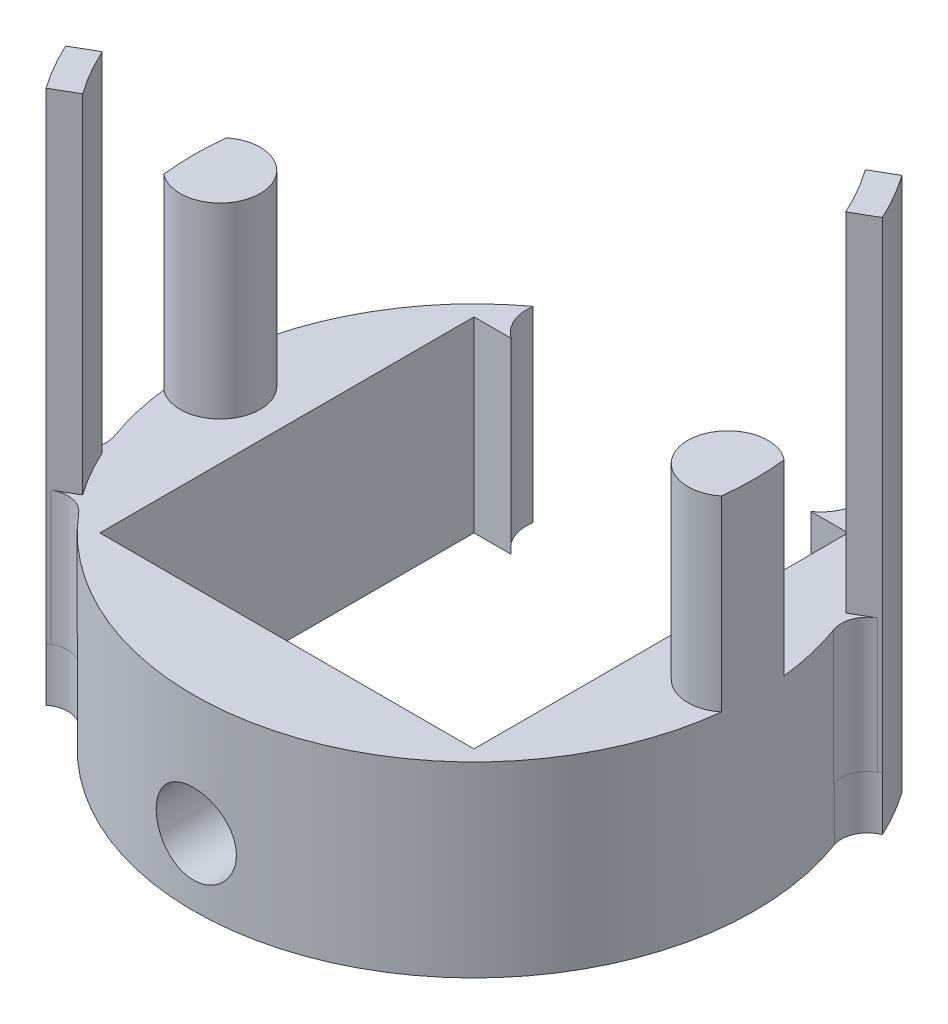
from build123d import *
from build123d.topology import SkipClean

# Parameters (mm, degrees)
SKETCH1_R               = 10.5
BOSS_EXTRUDE1_DEPTH     = 7
BOSS_EXTRUDE2_DEPTH     = 7
BOSS_EXTRUDE4_START     = -5
BOSS_EXTRUDE4_DEPTH     = 5
SKETCH5_R               = 1.5
CUT_EXTRUDE2_DEPTH      = 5
BOSS_EXTRUDE5_DEPTH     = 13
CUT_EXTRUDE4_DEPTH      = 26.013546021
CUT_EXTRUDE4_DEPTH_BACK = 26.013546021
FILLET1_R               = 1
CUT_EXTRUDE5_DEPTH      = 20.866491554
CUT_EXTRUDE5_DEPTH_BACK = 20.866491554
SKETCH9_R               = 15
SKETCH9_R_2             = 11.5
SKETCH10_R              = 1.5
CUT_EXTRUDE6_DEPTH      = 11.2
CUT_EXTRUDE7_DEPTH      = 24.334523869
CUT_EXTRUDE7_DEPTH_BACK = 24.334523869
SKETCH12_R              = 4.652991158
SKETCH12_R_2            = 1.5
BOSS_EXTRUDE6_START     = 2
BOSS_EXTRUDE6_DEPTH     = 2


with BuildPart() as part:
    # Sketch1 → Boss-Extrude1 (new body)
    with BuildSketch(Plane(origin=(0, 0, 0), x_dir=(1, 0, 0), z_dir=(0, 1, 0))):
        with Locations(Location((0, 0, 0), (0, 0, 270))):
            Circle(SKETCH1_R)
        Polygon((7, -7), (7, 0), (7, 7), (-7, 7), (-7, -7), align=None, mode=Mode.SUBTRACT)
    extrude(amount=BOSS_EXTRUDE1_DEPTH)

    # Sketch2 → Boss-Extrude2 (add)
    with BuildSketch(Plane(origin=(0, 7, 0), x_dir=(1, 0, 0), z_dir=(0, 1, 0))):
        with BuildLine():
            ThreePointArc((-10.434210526, -1.173563246), (-8.848584537, -1.351169084), (-8, 0))
            ThreePointArc((-8, 0), (-8.848584537, 1.351169084), (-10.434210526, 1.173563246))
            ThreePointArc((-10.434210526, 1.173563246), (-10.5, 0), (-10.434210526, -1.173563246))
        make_face()
        with BuildLine():
            ThreePointArc((10.434210526, 1.173563246), (8.848584537, 1.351169084), (8, 0))
            ThreePointArc((8, 0), (8.848584537, -1.351169084), (10.434210526, -1.173563246))
            ThreePointArc((10.434210526, -1.173563246), (10.5, 0), (10.434210526, 1.173563246))
        make_face()
    extrude(amount=BOSS_EXTRUDE2_DEPTH)

    # Sketch4 → Boss-Extrude4 (add)
    with BuildSketch(Plane(origin=(0, 7, 0), x_dir=(1, 0, 0), z_dir=(0, 1, 0)).offset(BOSS_EXTRUDE4_START)):
        with BuildLine():
            Line((-10.392304845, -6), (-9.09326674, -5.25))
            ThreePointArc((-9.09326674, -5.25), (-9.333212128, -4.810525062), (-9.551933495, -4.360110836))
            Line((-9.551933495, -4.360110836), (-10.743718377, -5.048188159))
            ThreePointArc((-10.743718377, -5.048188159), (-10.608541774, -5.539058011), (-10.392304845, -6))
        make_face()
        with BuildLine():
            Line((-9.09326674, -5.25), (-7, -4.041451884))
            Line((-7, -4.041451884), (-7, -2.886751346))
            Line((-7, -2.886751346), (-9.551933495, -4.360110836))
            ThreePointArc((-9.551933495, -4.360110836), (-9.333212128, -4.810525062), (-9.09326674, -5.25))
        make_face()
        with BuildLine():
            Line((-7, -5.196152423), (-7, -4.041451884))
            Line((-7, -4.041451884), (-9.09326674, -5.25))
            ThreePointArc((-9.09326674, -5.25), (-8.832642973, -5.677536271), (-8.551933495, -6.092161644))
            Line((-8.551933495, -6.092161644), (-7, -5.196152423))
        make_face()
        with BuildLine():
            ThreePointArc((-8.551933495, -6.092161644), (-8.832642973, -5.677536271), (-9.09326674, -5.25))
            Line((-9.09326674, -5.25), (-10.392304845, -6))
            ThreePointArc((-10.392304845, -6), (-10.101235838, -6.417737668), (-9.743718377, -6.780238966))
            Line((-9.743718377, -6.780238966), (-8.551933495, -6.092161644))
        make_face()
        with BuildLine():
            ThreePointArc((8.551933495, 6.092161644), (8.832642973, 5.677536271), (9.09326674, 5.25))
            Line((9.09326674, 5.25), (10.392304845, 6))
            ThreePointArc((10.392304845, 6), (10.101235838, 6.417737668), (9.743718377, 6.780238966))
            Line((9.743718377, 6.780238966), (8.551933495, 6.092161644))
        make_face()
        with BuildLine():
            Line((10.392304845, 6), (9.09326674, 5.25))
            ThreePointArc((9.09326674, 5.25), (9.333212128, 4.810525062), (9.551933495, 4.360110836))
            Line((9.551933495, 4.360110836), (10.743718377, 5.048188159))
            ThreePointArc((10.743718377, 5.048188159), (10.608541774, 5.539058011), (10.392304845, 6))
        make_face()
        with BuildLine():
            Line((7, 5.196152423), (7, 4.041451884))
            Line((7, 4.041451884), (9.09326674, 5.25))
            ThreePointArc((9.09326674, 5.25), (8.832642973, 5.677536271), (8.551933495, 6.092161644))
            Line((8.551933495, 6.092161644), (7, 5.196152423))
        make_face()
        with BuildLine():
            Line((9.09326674, 5.25), (7, 4.041451884))
            Line((7, 4.041451884), (7, 2.886751346))
            Line((7, 2.886751346), (9.551933495, 4.360110836))
            ThreePointArc((9.551933495, 4.360110836), (9.333212128, 4.810525062), (9.09326674, 5.25))
        make_face()
    extrude(amount=BOSS_EXTRUDE4_DEPTH)

    # Sketch5 → Cut-Extrude2 (cut)
    with BuildSketch(Plane(origin=(0, 7, 0), x_dir=(1, 0, 0), z_dir=(0, 1, 0))):
        with Locations((4.75, 8.227241336)):
            Circle(SKETCH5_R)
        with Locations((-4.75, 8.227241336)):
            Circle(SKETCH5_R)
    extrude(amount=-CUT_EXTRUDE2_DEPTH, mode=Mode.SUBTRACT)

    # Sketch6 → Boss-Extrude5 (add)
    with BuildSketch(Plane(origin=(0, 7, 0), x_dir=(1, 0, 0), z_dir=(0, 1, 0))):
        with BuildLine():
            Line((-9.551933495, -4.360110836), (-10.743718377, -5.048188159))
            ThreePointArc((-10.743718377, -5.048188159), (-10.392304845, -6), (-9.743718377, -6.780238966))
            Line((-9.743718377, -6.780238966), (-8.551933495, -6.092161644))
            ThreePointArc((-8.551933495, -6.092161644), (-9.09326674, -5.25), (-9.551933495, -4.360110836))
        make_face()
        with BuildLine():
            Line((9.743718377, 6.780238966), (8.551933495, 6.092161644))
            ThreePointArc((8.551933495, 6.092161644), (9.09326674, 5.25), (9.551933495, 4.360110836))
            Line((9.551933495, 4.360110836), (10.743718377, 5.048188159))
            ThreePointArc((10.743718377, 5.048188159), (10.392304845, 6), (9.743718377, 6.780238966))
        make_face()
    extrude(amount=BOSS_EXTRUDE5_DEPTH)

    # Sketch8 → Cut-Extrude4 (cut, two sides: drawn at the far end of the back side and taken through both)
    with BuildSketch(Plane.XY.offset(-CUT_EXTRUDE4_DEPTH_BACK)):
        with BuildLine():
            ThreePointArc((-1.216007768, 2.789525659), (-0.289525659, 1.283992232), (1.216007768, 2.210474341))
            Line((1.216007768, 2.210474341), (-1.216007768, 2.789525659))
        make_face()
        with BuildLine():
            Line((-1.216007768, 2.789525659), (1.216007768, 2.210474341))
            ThreePointArc((1.216007768, 2.210474341), (1.241472857, 2.354242857), (1.25, 2.5))
            ThreePointArc((1.25, 2.5), (0.145757143, 3.741472857), (-1.216007768, 2.789525659))
        make_face()
    extrude(amount=CUT_EXTRUDE4_DEPTH + CUT_EXTRUDE4_DEPTH_BACK, mode=Mode.SUBTRACT)

    # Fillet1
    fillet1_edges = [part.edges().sort_by_distance(p)[0] for p in [
        (-8.551933495, 4.5, 6.092161644),
        (-9.551933495, 4.5, 4.360110836),
        (8.551933495, 4.5, -6.092161644),
        (9.551933495, 4.5, -4.360110836),
    ]]
    fillet(fillet1_edges, radius=FILLET1_R)

    # Sketch9 → Cut-Extrude5 (cut, two sides: drawn at the far end of the back side and taken through both)
    with BuildSketch(Plane(origin=(0, 7, 0), x_dir=(1, 0, 0), z_dir=(0, 1, 0)).offset(-CUT_EXTRUDE5_DEPTH_BACK)):
        Circle(SKETCH9_R)
        Circle(SKETCH9_R_2, mode=Mode.SUBTRACT)
    extrude(amount=CUT_EXTRUDE5_DEPTH + CUT_EXTRUDE5_DEPTH_BACK, mode=Mode.SUBTRACT)

    # Sketch10 → Cut-Extrude6 (cut)
    with BuildSketch(Plane(origin=(0, 0, 7), x_dir=(-1, 0, 0), z_dir=(0, 0, -1))):
        with Locations((0, 2.5)):
            Circle(SKETCH10_R)
    extrude(amount=-CUT_EXTRUDE6_DEPTH, mode=Mode.SUBTRACT)

    # Sketch12 → Cut-Extrude7 (cut, two sides: drawn at the far end of the back side and taken through both)
    with BuildSketch(Plane(origin=(0, 2, 0), x_dir=(1, 0, 0), z_dir=(0, 1, 0)).offset(-CUT_EXTRUDE7_DEPTH_BACK)):
        with Locations((-0.127828636, 8.405111083)):
            Circle(SKETCH12_R)
        with Locations((-4.75, 8.227241336)):
            Circle(SKETCH12_R_2)
        with BuildLine():
            ThreePointArc((4.200769679, 9.623073007), (4.274324476, 9.649820963), (4.349174329, 9.67269586))
            ThreePointArc((4.349174329, 9.67269586), (-0.103811825, 13.058040258), (-4.591507729, 9.718844567))
            ThreePointArc((-4.591507729, 9.718844567), (-3.634711157, 9.23030205), (-3.25, 8.227241336))
            ThreePointArc((-3.25, 8.227241336), (-3.596964938, 7.267809136), (-4.477346862, 6.752229381))
            ThreePointArc((-4.477346862, 6.752229381), (-0.09444048, 3.752239717), (4.244962013, 6.814819079))
            ThreePointArc((4.244962013, 6.814819079), (4.059998471, 6.895363755), (3.887515969, 7))
            ThreePointArc((3.887515969, 7), (3.260583217, 8.405111083), (4.200769679, 9.623073007))
        make_face()
        with BuildLine():
            ThreePointArc((4.525162522, 8.405111083), (4.489847577, 8.977293846), (4.384438802, 9.540791183))
            ThreePointArc((4.384438802, 9.540791183), (4.292801386, 9.582372162), (4.200769679, 9.623073007))
            ThreePointArc((4.200769679, 9.623073007), (3.260583217, 8.405111083), (3.887515969, 7))
            Line((3.887515969, 7), (4.307933932, 7))
            ThreePointArc((4.307933932, 7), (4.470534699, 7.694209294), (4.525162522, 8.405111083))
        make_face()
        with BuildLine():
            ThreePointArc((5.612484031, 7), (6.081113452, 7.535766841), (6.25, 8.227241336))
            ThreePointArc((6.25, 8.227241336), (6.245854483, 8.338683539), (6.233440847, 8.449509761))
            ThreePointArc((6.233440847, 8.449509761), (5.336906018, 9.04253472), (4.384438802, 9.540791183))
            ThreePointArc((4.384438802, 9.540791183), (4.489847577, 8.977293846), (4.525162522, 8.405111083))
            ThreePointArc((4.525162522, 8.405111083), (4.470534699, 7.694209294), (4.307933932, 7))
            Line((4.307933932, 7), (5.612484031, 7))
        make_face()
    extrude(amount=CUT_EXTRUDE7_DEPTH + CUT_EXTRUDE7_DEPTH_BACK, mode=Mode.SUBTRACT)

    # Sketch13 → Boss-Extrude6 (add)
    with SkipClean():  # the faces are left unmerged after this step: merging them gives an invalid solid
        with BuildSketch(Plane.XZ.offset(-2).offset(BOSS_EXTRUDE6_START)):
            with BuildLine():
                ThreePointArc((9.421567416, -6.594245022), (9.699619412, -6.177975661), (9.959292144, -5.75))
                Line((9.959292144, -5.75), (9.09326674, -5.25))
                ThreePointArc((9.09326674, -5.25), (8.613877566, -6.004257929), (8.07208415, -6.715017311))
                ThreePointArc((8.07208415, -6.715017311), (8.722663603, -6.384648227), (9.421567416, -6.594245022))
            make_face()
            with BuildLine():
                Line((9.09326674, -5.25), (9.959292144, -5.75))
                ThreePointArc((9.959292144, -5.75), (10.200093572, -5.311128987), (10.421567416, -4.862194215))
                ThreePointArc((10.421567416, -4.862194215), (9.890599361, -4.361724155), (9.851417653, -3.63312128))
                ThreePointArc((9.851417653, -3.63312128), (9.506778681, -4.457707832), (9.09326674, -5.25))
            make_face()
            with BuildLine():
                ThreePointArc((-10.421567416, 4.862194215), (-9.890599361, 4.361724155), (-9.851417653, 3.63312128))
                ThreePointArc((-9.851417653, 3.63312128), (-9.09326674, 5.25), (-8.07208415, 6.715017311))
                ThreePointArc((-8.07208415, 6.715017311), (-8.722663603, 6.384648227), (-9.421567416, 6.594245022))
                ThreePointArc((-9.421567416, 6.594245022), (-9.959292144, 5.75), (-10.421567416, 4.862194215))
            make_face()
        extrude(amount=-BOSS_EXTRUDE6_DEPTH)


solid = part.part
